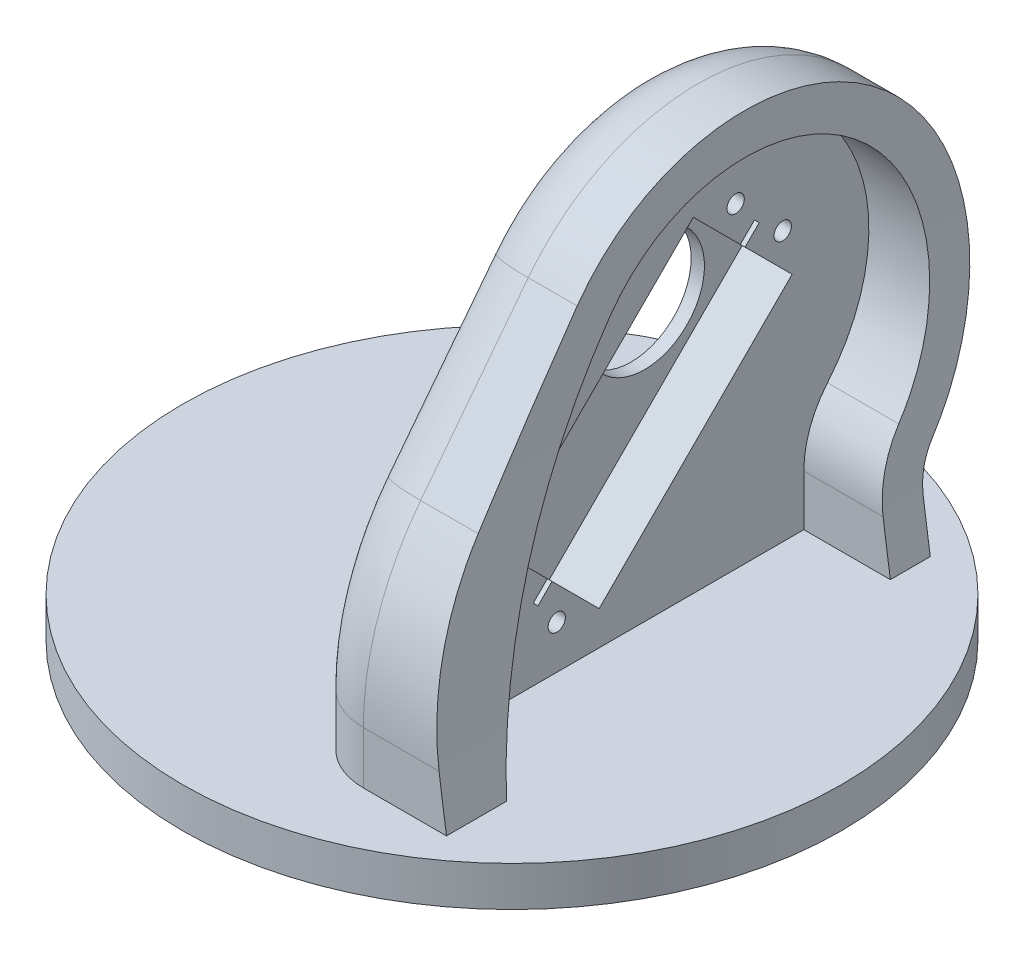
from build123d import *
from build123d.topology import SkipClean

# Parameters (mm, degrees)
SKETCH1_R                       = 49.5
BOSS_EXTRUDE1_DEPTH             = 6
BOSS_EXTRUDE2_START             = 4
SKETCH3_R                       = 9
BOSS_EXTRUDE2_DEPTH             = 14
SKETCH4_R                       = 1.5
CUT_EXTRUDE2_DEPTH              = 4
CUT_EXTRUDE3_START              = 6
SKETCH5_R                       = 1.3
CUT_EXTRUDE3_DEPTH              = 91.541405022
BOSS_EXTRUDE3_DEPTH             = 9
BOSS_EXTRUDE3_DIRECTION_2_REACH = 108.894
CUT_EXTRUDE4_DEPTH              = 101.767140704
CUT_EXTRUDE4_DEPTH_BACK         = 101.767140704
FILLET1_R                       = 10
SKETCH4_3_R                     = 1.5
CUT_EXTRUDE5_DEPTH              = 10
CUT_EXTRUDE6_DEPTH              = 8.5
CUT_EXTRUDE8_START              = -4.5
CUT_EXTRUDE8_DEPTH              = 4.5


with BuildPart() as part:
    # Sketch1 → Boss-Extrude1 (new body)
    with BuildSketch(Plane(origin=(0, 0, 0), x_dir=(1, 0, 0), z_dir=(0, 1, 0))):
        with Locations(Location((0, 0, 0), (0, 0, 270))):
            Circle(SKETCH1_R)
    extrude(amount=BOSS_EXTRUDE1_DEPTH)

    # Sketch3 → Boss-Extrude2 (add)
    with BuildSketch(Plane(origin=(0, 0, 0), x_dir=(0, 0, -1), z_dir=(1, 0, 0)).offset(BOSS_EXTRUDE2_START)):
        with BuildLine():
            Line((30.34, 6), (-30.34, 6))
            Line((-30.34, 6), (-30.34, 13.86))
            ThreePointArc((-30.34, 13.86), (-28.448562423, 25.248290284), (-22.977345695, 35.413745473))
            Line((-22.977345695, 35.413745473), (-6.815416301, 56.309885037))
            ThreePointArc((-6.815416301, 56.309885037), (30.399692788, 60.641486363), (33.897357348, 23.338759155))
            ThreePointArc((33.897357348, 23.338759155), (31.257393001, 18.805286063), (30.34, 13.64))
            Line((30.34, 13.64), (30.34, 6))
        make_face()
        with Locations((13.91, 40.28)):
            Circle(SKETCH3_R, mode=Mode.SUBTRACT)
    extrude(amount=BOSS_EXTRUDE2_DEPTH)

    # Sketch4 → Cut-Extrude2 (cut)
    with BuildSketch(Plane.XZ):
        with BuildLine():
            ThreePointArc((-5.911981132, 4.49211577), (-4.02628005, 8.050346325), (-3.375, 12.024350294))
            Line((-3.375, 12.024350294), (-3.375, 24))
            ThreePointArc((-3.375, 24), (0, 27.375), (3.375, 24))
            Line((3.375, 24), (3.375, 12.024350294))
            ThreePointArc((3.375, 12.024350294), (4.02628005, 8.050346325), (5.911981132, 4.49211577))
            ThreePointArc((5.911981132, 4.49211577), (0, -7.425), (-5.911981132, 4.49211577))
        make_face()
        with Locations(Location((0.008355438, 20, 0), (0, 0, 270))):
            Circle(SKETCH4_R, mode=Mode.SUBTRACT)
        with Locations(Location((0, 24, 0), (0, 0, 270))):
            Circle(SKETCH4_R, mode=Mode.SUBTRACT)
    extrude(amount=-CUT_EXTRUDE2_DEPTH, mode=Mode.SUBTRACT)

    # Sketch5 → Cut-Extrude3 (cut, through all)
    with BuildSketch(Plane(origin=(0, 0, 0), x_dir=(0, 0, -1), z_dir=(1, 0, 0)).offset(CUT_EXTRUDE3_START)):
        with Locations(Location((27.167164466, 46.465339059, 0), (0, 0, 180))):
            Circle(SKETCH5_R)
        with Locations(Location((20.096096654, 53.536406871, 0), (0, 0, 180))):
            Circle(SKETCH5_R)
        with Locations(Location((-13.845028843, 19.595281374, 0), (0, 0, 180))):
            Circle(SKETCH5_R)
        with Locations(Location((-6.773961031, 12.524213562, 0), (0, 0, 180))):
            Circle(SKETCH5_R)
        Polygon((-0.41, 11.11), (28.581378029, 40.101378029), (13.732135624, 54.950620434), (-15.259242405, 25.959242405), align=None)
    extrude(amount=CUT_EXTRUDE3_DEPTH, mode=Mode.SUBTRACT)

    # Sketch6 → Boss-Extrude3 (add)
    with BuildSketch(Plane(origin=(18, 0, 0), x_dir=(0, 0, -1), z_dir=(1, 0, 0))):
        with BuildLine():
            ThreePointArc((-7.323520562, 55.652945058), (-7.070150425, 55.981942529), (-6.815416301, 56.309885037))
            ThreePointArc((-6.815416301, 56.309885037), (30.399692788, 60.641486363), (33.897357348, 23.338759155))
            ThreePointArc((33.897357348, 23.338759155), (31.257393001, 18.805286063), (30.34, 13.64))
            Line((30.34, 13.64), (30.34, 6))
            Line((30.34, 6), (36.34, 6))
            Line((36.34, 6), (36.34, 13.64))
            ThreePointArc((36.34, 13.64), (36.890435801, 16.739171638), (38.474414409, 19.459255493))
            ThreePointArc((38.474414409, 19.459255493), (34.175793024, 65.304218074), (-11.561487098, 59.980690397))
            Line((-11.561487098, 59.980690397), (-27.723416492, 39.084550833))
            ThreePointArc((-27.723416492, 39.084550833), (-34.126432833, 27.187823116), (-36.34, 13.86))
            Line((-36.34, 13.86), (-36.34, 6))
            Line((-36.34, 6), (-30.34, 6))
            Line((-30.34, 6), (-30.34, 13.86))
            ThreePointArc((-30.34, 13.86), (-28.448562423, 25.248290284), (-22.977345695, 35.413745473))
            Line((-22.977345695, 35.413745473), (-7.323520562, 55.652945058))
        make_face()
        with BuildLine():
            ThreePointArc((-27.34, 6), (-20.716272, 32.190863083), (-7.323520562, 55.652945058))
            Line((-7.323520562, 55.652945058), (-22.977345695, 35.413745473))
            ThreePointArc((-22.977345695, 35.413745473), (-28.448562423, 25.248290284), (-30.34, 13.86))
            Line((-30.34, 13.86), (-30.34, 6))
            Line((-30.34, 6), (-27.34, 6))
        make_face()
    extrude(amount=BOSS_EXTRUDE3_DEPTH)

    # Boss-Extrude3 direction 2: up to this face of the body (flat: up to its plane)
    boss_extrude3_direction_2_end = Plane(part.part.faces().sort_by_distance((4, 32.233427389, -6.147611346))[0])
    # Sketch6 → Boss-Extrude3 direction 2 (add, up to the picked face)
    with BuildSketch(Plane(origin=(18, 0, 0), x_dir=(0, 0, -1), z_dir=(1, 0, 0)), mode=Mode.PRIVATE) as boss_extrude3_direction_2_sk1:
        with BuildLine():
            ThreePointArc((-7.323520562, 55.652945058), (-7.070150425, 55.981942529), (-6.815416301, 56.309885037))
            ThreePointArc((-6.815416301, 56.309885037), (30.399692788, 60.641486363), (33.897357348, 23.338759155))
            ThreePointArc((33.897357348, 23.338759155), (31.257393001, 18.805286063), (30.34, 13.64))
            Line((30.34, 13.64), (30.34, 6))
            Line((30.34, 6), (36.34, 6))
            Line((36.34, 6), (36.34, 13.64))
            ThreePointArc((36.34, 13.64), (36.890435801, 16.739171638), (38.474414409, 19.459255493))
            ThreePointArc((38.474414409, 19.459255493), (34.175793024, 65.304218074), (-11.561487098, 59.980690397))
            Line((-11.561487098, 59.980690397), (-27.723416492, 39.084550833))
            ThreePointArc((-27.723416492, 39.084550833), (-34.126432833, 27.187823116), (-36.34, 13.86))
            Line((-36.34, 13.86), (-36.34, 6))
            Line((-36.34, 6), (-30.34, 6))
            Line((-30.34, 6), (-30.34, 13.86))
            ThreePointArc((-30.34, 13.86), (-28.448562423, 25.248290284), (-22.977345695, 35.413745473))
            Line((-22.977345695, 35.413745473), (-7.323520562, 55.652945058))
        make_face()
    boss_extrude3_direction_2_tool1 = split(extrude(boss_extrude3_direction_2_sk1.sketch, amount=-BOSS_EXTRUDE3_DIRECTION_2_REACH, mode=Mode.PRIVATE), bisect_by=boss_extrude3_direction_2_end, keep=Keep.BOTH, mode=Mode.PRIVATE)
    # Sketch6 → Boss-Extrude3 direction 2 (add, up to the picked face)
    with BuildSketch(Plane(origin=(18, 0, 0), x_dir=(0, 0, -1), z_dir=(1, 0, 0)), mode=Mode.PRIVATE) as boss_extrude3_direction_2_sk2:
        with BuildLine():
            ThreePointArc((-27.34, 6), (-20.716272, 32.190863083), (-7.323520562, 55.652945058))
            Line((-7.323520562, 55.652945058), (-22.977345695, 35.413745473))
            ThreePointArc((-22.977345695, 35.413745473), (-28.448562423, 25.248290284), (-30.34, 13.86))
            Line((-30.34, 13.86), (-30.34, 6))
            Line((-30.34, 6), (-27.34, 6))
        make_face()
    boss_extrude3_direction_2_tool2 = split(extrude(boss_extrude3_direction_2_sk2.sketch, amount=-BOSS_EXTRUDE3_DIRECTION_2_REACH, mode=Mode.PRIVATE), bisect_by=boss_extrude3_direction_2_end, keep=Keep.BOTH, mode=Mode.PRIVATE)
    add(boss_extrude3_direction_2_tool1.solids().sort_by(Axis((18, 56.62993, 7.907949), (-1, 0, 0)))[0])
    add(boss_extrude3_direction_2_tool2.solids().sort_by(Axis((18, 24.594123, 24.897114), (-1, 0, 0)))[0])

    # Sketch7 → Cut-Extrude4 (cut, two sides: drawn at the far end of the back side and taken through both)
    with BuildSketch(Plane.XY.offset(-CUT_EXTRUDE4_DEPTH_BACK)):
        with BuildLine():
            Line((247.767802528, 72.481146829), (27, 72.481146829))
            Line((27, 72.481146829), (21, 72.481146829))
            ThreePointArc((21, 72.481146829), (22.640053286, 39.148747277), (26.5, 6))
            Line((26.5, 6), (27, 6))
            Line((27, 6), (247.767802528, 6))
            Line((247.767802528, 6), (689.303407584, 6))
            Line((689.303407584, 6), (689.303407584, 72.481146829))
            Line((689.303407584, 72.481146829), (247.767802528, 72.481146829))
        make_face()
    extrude(amount=CUT_EXTRUDE4_DEPTH + CUT_EXTRUDE4_DEPTH_BACK, mode=Mode.SUBTRACT)

    # Fillet1
    # the kernel refuses this fillet: 10 mm, written as the material it takes off along each edge
    with BuildSketch(Plane(origin=(4, 13.86, 36.34), x_dir=(0, 0, -1), z_dir=(0, -1, 0))) as fillet1_piece_1:
        with BuildLine():
            CenterArc((FILLET1_R, FILLET1_R), FILLET1_R, 180, 90)
            Line((0, FILLET1_R), (0, 0))
            Line((0, 0), (FILLET1_R, 0))
        make_face()
    extrude(amount=7.86, mode=Mode.SUBTRACT)
    with BuildSketch(Plane(origin=(4, 13.86, -4.89), x_dir=(0, 0.6118008933556042, 0.7910117994627416), z_dir=(0, 0.7910117994627416, -0.6118008933556042))) as fillet1_piece_2:
        with BuildLine():
            CenterArc((41.23 - FILLET1_R, FILLET1_R), FILLET1_R, 270, 90)
            Line((41.23, FILLET1_R), (41.23, 0))
            Line((41.23, 0), (41.23 - FILLET1_R, 0))
        make_face()
    revolve(axis=Axis((4, 13.86, -4.89), (1, 0, 0)), revolution_arc=37.719833498, mode=Mode.SUBTRACT)
    with BuildSketch(Plane(origin=(4, 59.980690397, 11.561487098), x_dir=(0, -0.6118008933556051, -0.791011799462741), z_dir=(0, -0.791011799462741, 0.6118008933556051))) as fillet1_piece_3:
        with BuildLine():
            CenterArc((FILLET1_R, FILLET1_R), FILLET1_R, 180, 90)
            Line((0, FILLET1_R), (0, 0))
            Line((0, 0), (FILLET1_R, 0))
        make_face()
    extrude(amount=26.4169758, mode=Mode.SUBTRACT)
    with BuildSketch(Plane(origin=(4, 40.28, -13.91), x_dir=(0, -0.646583943664495, -0.7628428434450107), z_dir=(0, -0.7628428434450107, 0.646583943664495))) as fillet1_piece_4:
        with BuildLine():
            CenterArc((32.201146829 - FILLET1_R, FILLET1_R), FILLET1_R, 270, 90)
            Line((32.201146829, FILLET1_R), (32.201146829, 0))
            Line((32.201146829, 0), (32.201146829 - FILLET1_R, 0))
        make_face()
    revolve(axis=Axis((4, 40.28, -13.91), (1, 0, 0)), revolution_arc=182.564704766, mode=Mode.SUBTRACT)
    with BuildSketch(Plane(origin=(4, 6, -36.34), x_dir=(0, 0, 1), z_dir=(0, 1, 0))) as fillet1_piece_5:
        with BuildLine():
            CenterArc((FILLET1_R, FILLET1_R), FILLET1_R, 180, 90)
            Line((0, FILLET1_R), (0, 0))
            Line((0, 0), (FILLET1_R, 0))
        make_face()
    extrude(amount=7.64, mode=Mode.SUBTRACT)
    with BuildSketch(Plane(origin=(4, 13.64, -45.34), x_dir=(0, 0.646583943664497, 0.7628428434450091), z_dir=(0, 0.7628428434450091, -0.646583943664497))) as fillet1_piece_6:
        with BuildLine():
            CenterArc((9 + FILLET1_R, FILLET1_R), FILLET1_R, 180, 90)
            Line((9, FILLET1_R), (9, 0))
            Line((9, 0), (9 + FILLET1_R, 0))
        make_face()
    revolve(axis=Axis((4, 13.64, -45.34), (1, 0, 0)), revolution_arc=40.284538264, mode=Mode.SUBTRACT)

    # Sketch4<3> → Cut-Extrude5 (cut)
    with BuildSketch(Plane.XZ):
        with Locations(Location((0, 24, 0), (0, 0, 270))):
            Circle(SKETCH4_3_R)
        with Locations(Location((0.008355438, 20, 0), (0, 0, 270))):
            Circle(SKETCH4_3_R)
    extrude(amount=-CUT_EXTRUDE5_DEPTH, mode=Mode.SUBTRACT)

    # Sketch8 → Cut-Extrude6 (cut)
    with BuildSketch(Plane(origin=(18, 0, 0), x_dir=(0, 0, -1), z_dir=(1, 0, 0))):
        Polygon((-8.188174593, 18.888174593), (-7.481067812, 18.181067812), (-9.602388155, 16.059747468), (-10.309494937, 16.766854249), align=None)
        Polygon((22.924523779, 50.000872965), (20.803203436, 47.879552622), (21.510310217, 47.172445841), (23.63163056, 49.293766184), align=None)
    extrude(amount=-CUT_EXTRUDE6_DEPTH, mode=Mode.SUBTRACT)

    # Sketch9 → Cut-Extrude8 (cut)
    with SkipClean():  # the faces are left unmerged after this step: merging them gives an invalid solid
        with BuildSketch(Plane(origin=(18, 0, 0), x_dir=(0, 0, -1), z_dir=(1, 0, 0)).offset(CUT_EXTRUDE8_START)):
            with BuildLine():
                Line((-27.34, 6), (30.34, 6))
                Line((30.34, 6), (30.34, 13.64))
                ThreePointArc((30.34, 13.64), (31.257393001, 18.805286063), (33.897357348, 23.338759155))
                ThreePointArc((33.897357348, 23.338759155), (30.399692788, 60.641486363), (-6.815416301, 56.309885037))
                Line((-6.815416301, 56.309885037), (-7.323520562, 55.652945058))
                ThreePointArc((-7.323520562, 55.652945058), (-20.716272, 32.190863083), (-27.34, 6))
            make_face()
        extrude(amount=CUT_EXTRUDE8_DEPTH, mode=Mode.SUBTRACT)
    add(part.part.scale(1), mode=Mode.REPLACE)  # the faces are merged on a copy


solid = part.part
